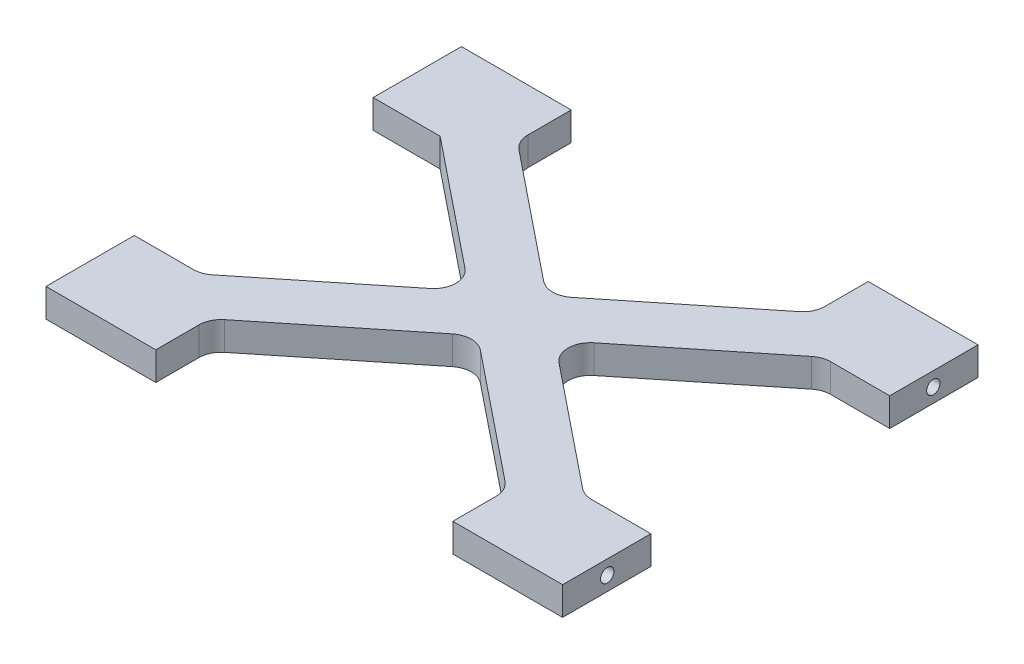
from build123d import *

# Parameters (mm, degrees)
BOSS_EXTRUDE1_DEPTH = 6.35
FILLET1_R           = 5
SKETCH2_R           = 1.5
CUT_EXTRUDE1_DEPTH  = 20


with BuildPart() as part:
    # Sketch1 → Boss-Extrude1 (new body)
    with BuildSketch(Plane(origin=(0, 0, 0), x_dir=(1, 0, 0), z_dir=(0, 1, 0))):
        Polygon((-57.825, 26.738412941), (-42.825, 26.738412941), (-9.574489714, 0), (-42.825, -26.738412941), (-57.825, -26.738412941), (-57.825, -46.5), (-33.250510286, -46.5), (-33.250510286, -34.437743191), (0, -7.69933025), (33.250510286, -34.437743191), (33.250510286, -46.5), (57.825, -46.5), (57.825, -26.738412941), (42.825, -26.738412941), (9.574489714, 0), (42.825, 26.738412941), (57.825, 26.738412941), (57.825, 46.5), (33.250510286, 46.5), (33.250510286, 34.437743191), (0, 7.69933025), (-33.250510286, 34.437743191), (-33.250510286, 46.5), (-57.825, 46.5), align=None)
    extrude(amount=BOSS_EXTRUDE1_DEPTH)

    # Fillet1
    fillet1_edges = [part.edges().sort_by_distance(p)[0] for p in [
        (-33.250510286, 3.175, -34.437743191),
        (33.250510286, 3.175, -34.437743191),
        (42.825, 3.175, -26.738412941),
        (42.825, 3.175, 26.738412941),
        (33.250510286, 3.175, 34.437743191),
        (-33.250510286, 3.175, 34.437743191),
        (-42.825, 3.175, 26.738412941),
        (-9.574489714, 3.175, 0),
        (0, 3.175, -7.69933025),
        (9.574489714, 3.175, 0),
        (0, 3.175, 7.69933025),
    ]]
    fillet(fillet1_edges, radius=FILLET1_R)

    # Sketch2 → Cut-Extrude1 (cut)
    with BuildSketch(Plane(origin=(57.825, 0, 0), x_dir=(0, 0, -1), z_dir=(1, 0, 0))):
        with Locations((36.5, 3.175)):
            Circle(SKETCH2_R)
        with Locations((-36.5, 3.175)):
            Circle(SKETCH2_R)
    cut_extrude1 = extrude(amount=-CUT_EXTRUDE1_DEPTH, mode=Mode.SUBTRACT)

    # Mirror1: Cut-Extrude1 across plane
    add(cut_extrude1.mirror(Plane(origin=(0, 0, 0), x_dir=(0, 0, 1), z_dir=(1, 0, 0))), mode=Mode.SUBTRACT)


solid = part.part
